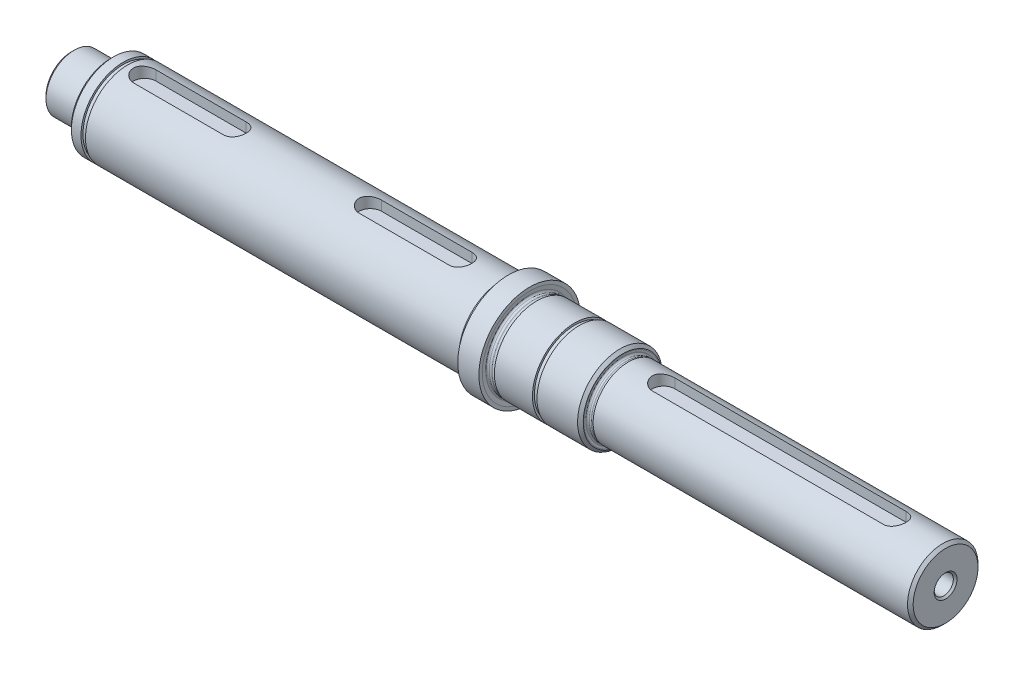
from build123d import *

# Parameters (mm, degrees)
SCHNITT_LINEAR_AUSTRAGEN1_DEPTH = 4
M8_GEWINDEBOHRUNG1_D            = 6.8
M8_GEWINDEBOHRUNG1_DEPTH        = 26.25
M8_GEWINDEBOHRUNG1_CSINK_D      = 8.1
M8_GEWINDEBOHRUNG1_CSINK_ANGLE  = 90
M8_GEWINDEBOHRUNG1_TIP          = 2.042926105
M8_GEWINDEBOHRUNG2_D            = 6.8
M8_GEWINDEBOHRUNG2_DEPTH        = 26.25
M8_GEWINDEBOHRUNG2_CSINK_D      = 8.1
M8_GEWINDEBOHRUNG2_CSINK_ANGLE  = 90
M8_GEWINDEBOHRUNG2_TIP          = 2.042926105
SCHNITT_LINEAR_AUSTRAGEN2_DEPTH = 4
SCHNITT_F_T2_DEPTH              = 2.5
SCHNITT_F_T2_DEPTH_BACK         = 0.2
G_T1_R                          = 16.8
G_T1_R_2                        = 14.7
FASE_8_T2_SIZE2                 = 1.423073944
FASE_8_T2_SIZE                  = 0.2
RADIUS_R_R                      = 0.6
SCHNITT_F_T21_DEPTH             = 2.5
SCHNITT_F_T21_DEPTH_BACK        = 0.2
G_T11_R                         = 16.8
G_T11_R_2                       = 14.7
FASE_8_T21_SIZE2                = 1.423073944
FASE_8_T21_SIZE                 = 0.2
RADIUS_R1_R                     = 0.6
SCHNITT_F_T23_DEPTH             = 2
SCHNITT_F_T23_DEPTH_BACK        = 0.1
G_T13_R                         = 13.7
G_T13_R_2                       = 12.3
FASE_8_T23_SIZE2                = 0.711536972
FASE_8_T23_SIZE                 = 0.1
RADIUS_R3_R                     = 0.6
SCHNITT_F_T24_DEPTH             = 2.5
SCHNITT_F_T24_DEPTH_BACK        = 0.2
G_T14_R                         = 11.8
G_T14_R_2                       = 9.7
FASE_8_T24_SIZE2                = 1.423073944
FASE_8_T24_SIZE                 = 0.2
RADIUS_R4_R                     = 0.6


with BuildPart() as part:
    # Skizze1 → Basis-Rotation (revolve)
    with BuildSketch(Plane.XY, mode=Mode.PRIVATE) as basis_rotation_sk:
        Polygon((-162.5, 9), (-162.5, 0), (147.5, 0), (147.5, 11.5), (146.5, 12.5), (33, 12.5), (33, 14), (32, 15), (17.6, 15), (17.6, 14.3), (16, 14.3), (16, 15), (0, 15), (0, 18), (-7.5, 18), (-7.5, 15), (-142.5, 15), (-142.5, 14.3), (-144.1, 14.3), (-144.1, 15), (-147.5, 15), (-148.5, 14), (-148.5, 10), (-161.5, 10), align=None)
    revolve(basis_rotation_sk.sketch.rotate(Axis((-171.313553592, 0, 0), (1, 0, 0)), 180), axis=Axis((-171.313553592, 0, 0), (1, 0, 0)))

    # Skizze2 → Schnitt-Linear austragen1 (cut)
    with BuildSketch(Plane(origin=(0, 12.5, 0), x_dir=(-1, 0, 0), z_dir=(0, 1, 0))):
        with BuildLine():
            Line((-129.5, 4), (-47.5, 4))
            ThreePointArc((-47.5, 4), (-43.5, 0), (-47.5, -4))
            Line((-47.5, -4), (-129.5, -4))
            ThreePointArc((-129.5, -4), (-133.5, 0), (-129.5, 4))
        make_face()
    extrude(amount=-SCHNITT_LINEAR_AUSTRAGEN1_DEPTH, mode=Mode.SUBTRACT)

    # M8 Gewindebohrung1
    with Locations(Plane.ZY.offset(162.5)):
        with Locations((0, 0)):
            CounterSinkHole(M8_GEWINDEBOHRUNG1_D / 2, M8_GEWINDEBOHRUNG1_CSINK_D / 2, depth=M8_GEWINDEBOHRUNG1_DEPTH, counter_sink_angle=M8_GEWINDEBOHRUNG1_CSINK_ANGLE)
            with Locations((0, 0, -(M8_GEWINDEBOHRUNG1_DEPTH + M8_GEWINDEBOHRUNG1_TIP / 2))):  # 118° drill point
                Cone(0, M8_GEWINDEBOHRUNG1_D / 2, M8_GEWINDEBOHRUNG1_TIP, mode=Mode.SUBTRACT)

    # M8 Gewindebohrung2
    with Locations(Plane(origin=(147.5, 0, 0), x_dir=(0, 0, -1), z_dir=(1, 0, 0))):
        with Locations((0, 0)):
            CounterSinkHole(M8_GEWINDEBOHRUNG2_D / 2, M8_GEWINDEBOHRUNG2_CSINK_D / 2, depth=M8_GEWINDEBOHRUNG2_DEPTH, counter_sink_angle=M8_GEWINDEBOHRUNG2_CSINK_ANGLE)
            with Locations((0, 0, -(M8_GEWINDEBOHRUNG2_DEPTH + M8_GEWINDEBOHRUNG2_TIP / 2))):  # 118° drill point
                Cone(0, M8_GEWINDEBOHRUNG2_D / 2, M8_GEWINDEBOHRUNG2_TIP, mode=Mode.SUBTRACT)

    # Skizze7 → Schnitt-Linear austragen2 (cut)
    with BuildSketch(Plane(origin=(0, 15, 0), x_dir=(1, 0, 0), z_dir=(0, 1, 0))):
        with BuildLine():
            Line((-136.5, 4), (-104.5, 4))
            ThreePointArc((-104.5, 4), (-100.5, 0), (-104.5, -4))
            Line((-104.5, -4), (-136.5, -4))
            ThreePointArc((-136.5, -4), (-140.5, 0), (-136.5, 4))
        make_face()
        with BuildLine():
            Line((-56.5, 4), (-24.5, 4))
            ThreePointArc((-24.5, 4), (-20.5, 0), (-24.5, -4))
            Line((-24.5, -4), (-56.5, -4))
            ThreePointArc((-56.5, -4), (-60.5, 0), (-56.5, 4))
        make_face()
    extrude(amount=-SCHNITT_LINEAR_AUSTRAGEN2_DEPTH, mode=Mode.SUBTRACT)

    # g+t1 → Schnitt f+t2 (cut, two sides: drawn at the far end of the back side and taken through both)
    with BuildSketch(Plane(origin=(0, 15.68322907, -5.369686321), x_dir=(0, 0, -1), z_dir=(1, 0, 0)).offset(-SCHNITT_F_T2_DEPTH_BACK)):
        with Locations(Location((-5.369686321, -15.68322907, 0), (0, 0, 270))):
            Circle(G_T1_R)
        with Locations(Location((-5.369686321, -15.68322907, 0), (0, 0, 90))):
            Circle(G_T1_R_2, mode=Mode.SUBTRACT)
    extrude(amount=SCHNITT_F_T2_DEPTH + SCHNITT_F_T2_DEPTH_BACK, mode=Mode.SUBTRACT)

    # Fase 15° t1: read off the stored shape, not the designer's step
    # Fase 15° t1 outline → Fase 15° t1 (revolve)
    with BuildSketch(Plane.YX):
        Polygon((14.7, 2.5), (14.7, 1.380384758), (15, 2.5), align=None)
    revolve(axis=Axis((0, 0, 0), (1, 0, 0)))

    # Fase 8° t2
    fase_8_t2_edges = [part.edges().sort_by_distance(p)[0] for p in [
        (-0.2, 16.8, 0),
    ]]
    fase_8_t2_side = [part.faces().sort_by_distance(p)[0] for p in [
        (-0.196, 16.8, 0),
    ]]
    chamfer(fase_8_t2_edges, length=FASE_8_T2_SIZE - 0.0001, length2=FASE_8_T2_SIZE2 - 0.0001, reference=fase_8_t2_side[0])  # a hair under: the kernel refuses the full size

    # Radius r
    radius_r_edges = [part.edges().sort_by_distance(p)[0] for p in [
        (-0.2, -14.7, 0),
        (1.380384758, -14.7, 0),
    ]]
    fillet(radius_r_edges, radius=RADIUS_R_R)

    # g+t11 → Schnitt f+t21 (cut, two sides: drawn at the far end of the back side and taken through both)
    with BuildSketch(Plane(origin=(-7.5, 15.606103007, 0.578312963), x_dir=(0, 0, 1), z_dir=(-1, 0, 0)).offset(-SCHNITT_F_T21_DEPTH_BACK)):
        with Locations(Location((-0.578312963, -15.606103007, 0), (0, 0, 90))):
            Circle(G_T11_R)
        with Locations(Location((-0.578312963, -15.606103007, 0), (0, 0, 270))):
            Circle(G_T11_R_2, mode=Mode.SUBTRACT)
    extrude(amount=SCHNITT_F_T21_DEPTH + SCHNITT_F_T21_DEPTH_BACK, mode=Mode.SUBTRACT)

    # Fase 15° t11: read off the stored shape, not the designer's step
    # Fase 15° t11 outline → Fase 15° t11 (revolve)
    with BuildSketch(Plane.YX):
        Polygon((15, -10), (14.7, -8.880384758), (14.7, -10), align=None)
    revolve(axis=Axis((0, 0, 0), (1, 0, 0)))

    # Fase 8° t21
    fase_8_t21_edges = [part.edges().sort_by_distance(p)[0] for p in [
        (-7.3, -16.8, 0),
    ]]
    fase_8_t21_side = [part.faces().sort_by_distance(p)[0] for p in [
        (-7.304, -16.8, 0),
    ]]
    chamfer(fase_8_t21_edges, length=FASE_8_T21_SIZE - 0.0001, length2=FASE_8_T21_SIZE2 - 0.0001, reference=fase_8_t21_side[0])  # a hair under: the kernel refuses the full size

    # Radius r1
    radius_r1_edges = [part.edges().sort_by_distance(p)[0] for p in [
        (-7.3, 14.7, 0),
        (-8.880384758, 0, 14.7),
    ]]
    fillet(radius_r1_edges, radius=RADIUS_R1_R)

    # g+t13 → Schnitt f+t23 (cut, two sides: drawn at the far end of the back side and taken through both)
    with BuildSketch(Plane(origin=(33, -2.98315193, 12.673044335), x_dir=(0, 0, -1), z_dir=(1, 0, 0)).offset(-SCHNITT_F_T23_DEPTH_BACK)):
        with Locations(Location((12.673044335, 2.98315193, 0), (0, 0, 270))):
            Circle(G_T13_R)
        with Locations(Location((12.673044335, 2.98315193, 0), (0, 0, 90))):
            Circle(G_T13_R_2, mode=Mode.SUBTRACT)
    extrude(amount=SCHNITT_F_T23_DEPTH + SCHNITT_F_T23_DEPTH_BACK, mode=Mode.SUBTRACT)

    # Fase 15° t13: read off the stored shape, not the designer's step
    # Fase 15° t13 outline → Fase 15° t13 (revolve)
    with BuildSketch(Plane.YX):
        Polygon((12.3, 35), (12.3, 34.253589838), (12.5, 35), align=None)
    revolve(axis=Axis((0, 0, 0), (1, 0, 0)))

    # Fase 8° t23
    fase_8_t23_edges = [part.edges().sort_by_distance(p)[0] for p in [
        (32.9, 13.7, 0),
    ]]
    fase_8_t23_side = [part.faces().sort_by_distance(p)[0] for p in [
        (32.902, 13.7, 0),
    ]]
    chamfer(fase_8_t23_edges, length=FASE_8_T23_SIZE - 0.0001, length2=FASE_8_T23_SIZE2 - 0.0001, reference=fase_8_t23_side[0])  # a hair under: the kernel refuses the full size

    # Radius r3
    radius_r3_edges = [part.edges().sort_by_distance(p)[0] for p in [
        (32.9, -12.3, 0),
        (34.253589838, -12.3, 0),
    ]]
    fillet(radius_r3_edges, radius=RADIUS_R3_R)

    # g+t14 → Schnitt f+t24 (cut, two sides: drawn at the far end of the back side and taken through both)
    with BuildSketch(Plane(origin=(-148.5, 10.196326486, -4.264703849), x_dir=(0, 0, 1), z_dir=(-1, 0, 0)).offset(-SCHNITT_F_T24_DEPTH_BACK)):
        with Locations(Location((4.264703849, -10.196326486, 0), (0, 0, 90))):
            Circle(G_T14_R)
        with Locations(Location((4.264703849, -10.196326486, 0), (0, 0, 270))):
            Circle(G_T14_R_2, mode=Mode.SUBTRACT)
    extrude(amount=SCHNITT_F_T24_DEPTH + SCHNITT_F_T24_DEPTH_BACK, mode=Mode.SUBTRACT)

    # Fase 15° t14: read off the stored shape, not the designer's step
    # Fase 15° t14 outline → Fase 15° t14 (revolve)
    with BuildSketch(Plane.YX):
        Polygon((10, -151), (9.7, -149.880384758), (9.7, -151), align=None)
    revolve(axis=Axis((0, 0, 0), (1, 0, 0)))

    # Fase 8° t24
    fase_8_t24_edges = [part.edges().sort_by_distance(p)[0] for p in [
        (-148.3, -11.8, 0),
    ]]
    fase_8_t24_side = [part.faces().sort_by_distance(p)[0] for p in [
        (-148.304, -11.8, 0),
    ]]
    chamfer(fase_8_t24_edges, length=FASE_8_T24_SIZE - 0.0001, length2=FASE_8_T24_SIZE2 - 0.0001, reference=fase_8_t24_side[0])  # a hair under: the kernel refuses the full size

    # Radius r4
    radius_r4_edges = [part.edges().sort_by_distance(p)[0] for p in [
        (-148.3, 9.7, 0),
        (-149.880384758, 0, 9.7),
    ]]
    fillet(radius_r4_edges, radius=RADIUS_R4_R)


solid = part.part
